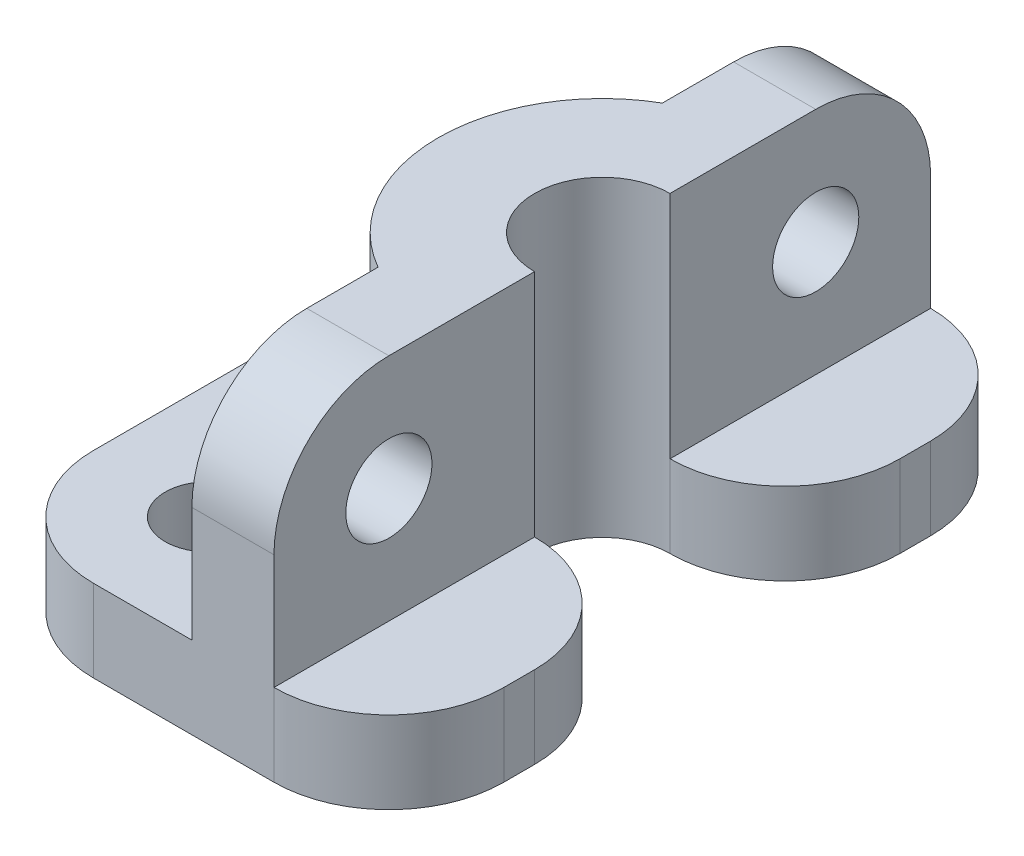
from build123d import *

# Parameters (mm, degrees)
SKETCH1_W                = 18
SKETCH1_H                = 40
BOSS_EXTRUDE1_DEPTH      = 5
BOSS_EXTRUDE2_DEPTH      = 14
SKETCH3_R                = 4.125
CUT_EXTRUDE1_DEPTH       = 30.017236257
FILLET1_R                = 7
SKETCH6_R                = 2.625
CUT_EXTRUDE3_DEPTH       = 33.939338184
SKETCH7_W                = 15.875
SKETCH7_H                = 5
BOSS_EXTRUDE3_DEPTH      = 7
FILLET2_R                = 7
SKETCH8_R                = 2.625
CUT_EXTRUDE4_DEPTH       = 30.189039039
BOSS_EXTRUDE4_DEPTH      = 2.5
BOSS_EXTRUDE4_DEPTH_BACK = 2.5


with BuildPart() as part:
    # Sketch1 → Boss-Extrude1 (new body)
    with BuildSketch(Plane(origin=(0, 0, 0), x_dir=(1, 0, 0), z_dir=(0, 1, 0))):
        Rectangle(SKETCH1_W, SKETCH1_H)
    extrude(amount=BOSS_EXTRUDE1_DEPTH)

    # Sketch2 → Boss-Extrude2 (add)
    with BuildSketch(Plane(origin=(0, 5, 0), x_dir=(1, 0, 0), z_dir=(0, 1, 0))):
        with BuildLine():
            Line((4, -20), (4, -8.660254038))
            ThreePointArc((4, -8.660254038), (-1, 0), (4, 8.660254038))
            Line((4, 8.660254038), (4, 20))
            Line((4, 20), (9, 20))
            Line((9, 20), (9, -20))
            Line((9, -20), (4, -20))
        make_face()
    extrude(amount=BOSS_EXTRUDE2_DEPTH)

    # Sketch3 → Cut-Extrude1 (cut, through all)
    with BuildSketch(Plane(origin=(0, 19, 0), x_dir=(1, 0, 0), z_dir=(0, 1, 0))):
        with Locations((9, 0)):
            Circle(SKETCH3_R)
    extrude(amount=-CUT_EXTRUDE1_DEPTH, mode=Mode.SUBTRACT)

    # Fillet1
    fillet1_edges = [part.edges().sort_by_distance(p)[0] for p in [
        (6.5, 19, 20),
        (6.5, 19, -20),
    ]]
    fillet(fillet1_edges, radius=FILLET1_R)

    # Sketch6 → Cut-Extrude3 (cut, through all)
    with BuildSketch(Plane(origin=(9, 0, 0), x_dir=(0, 0, -1), z_dir=(1, 0, 0))):
        with Locations((-13, 12)):
            Circle(SKETCH6_R)
        with Locations((13, 12)):
            Circle(SKETCH6_R)
    extrude(amount=-CUT_EXTRUDE3_DEPTH, mode=Mode.SUBTRACT)

    # Sketch7 → Boss-Extrude3 (add)
    with BuildSketch(Plane(origin=(9, 0, 0), x_dir=(0, 0, -1), z_dir=(1, 0, 0))):
        with Locations((-12.0625, 2.5)):
            Rectangle(SKETCH7_W, SKETCH7_H)
        with Locations((12.0625, 2.5)):
            Rectangle(SKETCH7_W, SKETCH7_H)
    extrude(amount=BOSS_EXTRUDE3_DEPTH)

    # Fillet2
    fillet2_edges = [part.edges().sort_by_distance(p)[0] for p in [
        (-9, 2.5, -20),
        (16, 2.5, -20),
        (16, 2.5, 20),
        (-9, 2.5, 20),
        (16, 2.5, -4.125),
        (16, 2.5, 4.125),
    ]]
    fillet(fillet2_edges, radius=FILLET2_R - 0.0001)  # a hair under: the kernel refuses the full size

    # Sketch8 → Cut-Extrude4 (cut, through all)
    with BuildSketch(Plane(origin=(0, 5, 0), x_dir=(1, 0, 0), z_dir=(0, 1, 0))):
        with Locations(Location((-2, 13, 0), (0, 0, 270))):
            Circle(SKETCH8_R)
        with Locations(Location((-2, -13, 0), (0, 0, 90))):
            Circle(SKETCH8_R)
    extrude(amount=-CUT_EXTRUDE4_DEPTH, mode=Mode.SUBTRACT)

    # Sketch9 → Boss-Extrude4 (add, two sides: drawn at the far end of the back side and taken through both)
    with BuildSketch(Plane.XY.offset(-BOSS_EXTRUDE4_DEPTH_BACK)):
        Polygon((-9, 5), (2, 16), (2, 5), align=None)
    extrude(amount=BOSS_EXTRUDE4_DEPTH + BOSS_EXTRUDE4_DEPTH_BACK)


solid = part.part
